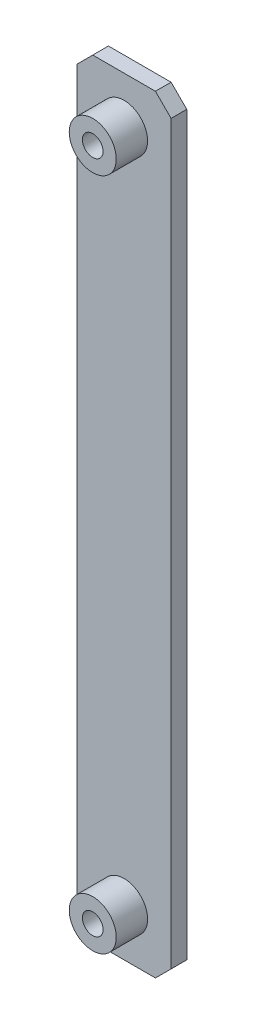
from build123d import *
from build123d.topology import SkipClean

# Parameters (mm, degrees)
SKETCH1_W                    = 9.525
SKETCH1_H                    = 77.7875
BOSS_EXTRUDE1_DEPTH          = 1.5875
CHAMFER2_SIZE                = 1.5875
F_97_0_0825_DIAMETER_HOLE1_D = 2.0955
SKETCH5_R                    = 2.38125
SKETCH5_R_2                  = 1.04775
BOSS_EXTRUDE2_DEPTH          = 3.175


with BuildPart() as part:
    # Sketch1 → Boss-Extrude1 (new body)
    with BuildSketch(Plane.XY):
        with Locations((-4.7625, 38.89375)):
            Rectangle(SKETCH1_W, SKETCH1_H)
    extrude(amount=BOSS_EXTRUDE1_DEPTH)

    # Chamfer2
    chamfer2_edges = [part.edges().sort_by_distance(p)[0] for p in [
        (0, 77.7875, 0.79375),
        (-9.525, 77.7875, 0.79375),
        (0, 0, 0.79375),
        (-9.525, 0, 0.79375),
    ]]
    chamfer(chamfer2_edges, length=CHAMFER2_SIZE)

    # #97 (0.0825) Diameter Hole1 (through all)
    with Locations(Plane.XY.offset(1.5875)):
        with Locations((-4.7625, 4.7625), (-4.7625, 73.025)):
            Hole(F_97_0_0825_DIAMETER_HOLE1_D / 2)

    # Sketch5 → Boss-Extrude2 (add)
    # profile 1 of 2: a face of its own
    with SkipClean():  # the faces are left unmerged after this step: merging them gives an invalid solid
        with BuildSketch(Plane.XY.offset(1.5875)):
            with Locations((-4.7625, 4.7625)):
                Circle(SKETCH5_R)
            with Locations((-4.7625, 4.7625)):
                Circle(SKETCH5_R_2, mode=Mode.SUBTRACT)
        # profile 2 of 2: a face of its own
        with BuildSketch(Plane.XY.offset(1.5875)):
            with Locations((-4.7625, 73.025)):
                Circle(SKETCH5_R)
            with Locations((-4.7625, 73.025)):
                Circle(SKETCH5_R_2, mode=Mode.SUBTRACT)
        extrude(amount=BOSS_EXTRUDE2_DEPTH)
    add(part.part.scale(1), mode=Mode.REPLACE)  # the faces are merged on a copy


solid = part.part
